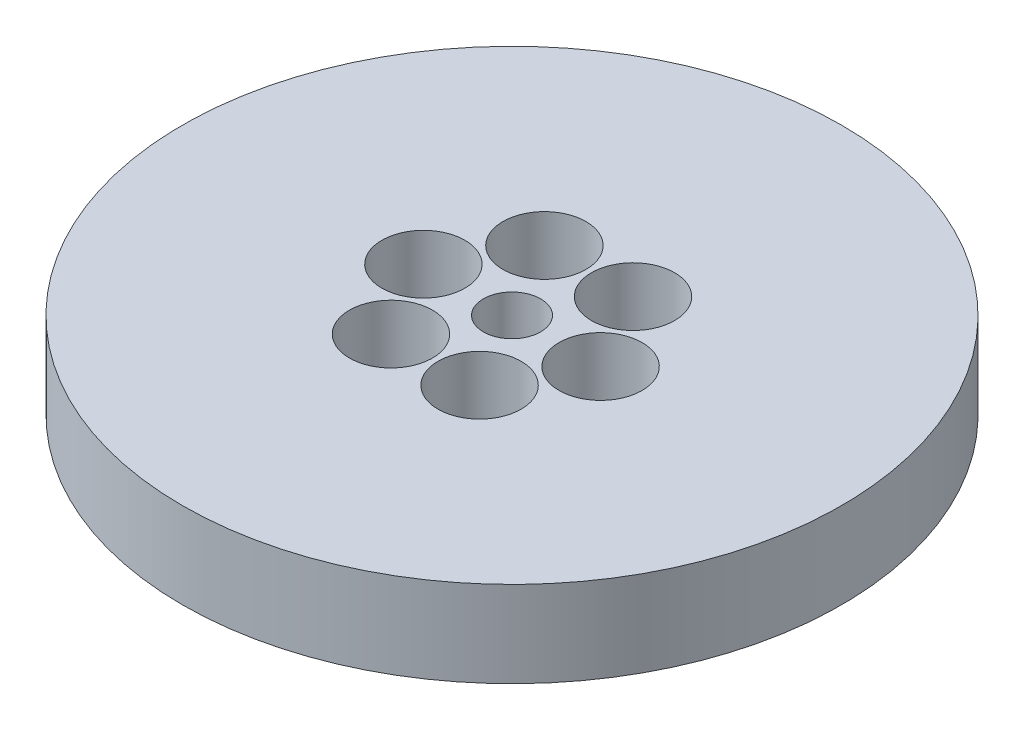
from build123d import *

# Parameters (mm, degrees)
SKETCH1_R           = 57.5
BOSS_EXTRUDE1_DEPTH = 15
SKETCH2_R           = 5
CUT_EXTRUDE1_DEPTH  = 83.689177043
SKETCH3_R           = 7.248164477
CUT_EXTRUDE2_DEPTH  = 14.263323745
CIRPATTERN1_COUNT   = 6


with BuildPart() as part:
    # Sketch1 → Boss-Extrude1 (new body)
    with BuildSketch(Plane(origin=(0, 0, 0), x_dir=(1, 0, 0), z_dir=(0, 1, 0))):
        Circle(SKETCH1_R)
    extrude(amount=BOSS_EXTRUDE1_DEPTH)

    # Sketch2 → Cut-Extrude1 (cut, through all)
    with BuildSketch(Plane(origin=(0, 0, 0), x_dir=(1, 0, 0), z_dir=(0, 1, 0))):
        Circle(SKETCH2_R)
    extrude(amount=CUT_EXTRUDE1_DEPTH, mode=Mode.SUBTRACT)

    # Sketch3 → Cut-Extrude2 (cut)
    with BuildSketch(Plane(origin=(0, 15, 0), x_dir=(1, 0, 0), z_dir=(0, 1, 0))):
        with Locations((-15.457473533, 0)):
            Circle(SKETCH3_R)
    cut_extrude2 = extrude(amount=-CUT_EXTRUDE2_DEPTH, mode=Mode.SUBTRACT)

    # CirPattern1: Cut-Extrude2 ×6 about axis
    cirpattern1_axis = Axis((0, 0, 0), (0, 1, 0))
    for i in range(1, CIRPATTERN1_COUNT):
        add(cut_extrude2.rotate(cirpattern1_axis, i * 360 / CIRPATTERN1_COUNT), mode=Mode.SUBTRACT)


solid = part.part
